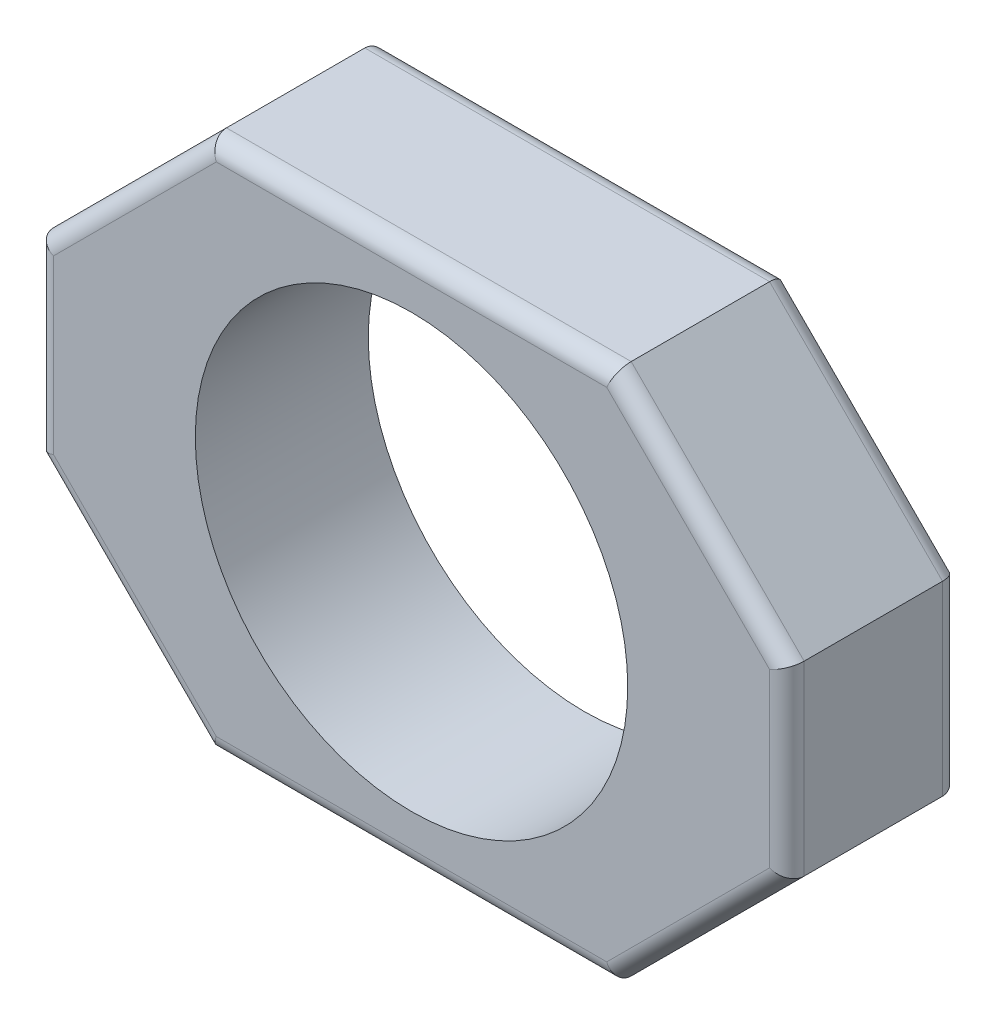
from build123d import *

# Parameters (mm, degrees)
SKETCH1_W           = 110.237040332
SKETCH1_H           = 78.14500721
BOSS_EXTRUDE1_DEPTH = 25.4
SKETCH2_R           = 31.75
CUT_EXTRUDE1_DEPTH  = 73.179441694
CHAMFER1_SIZE       = 25.4
FILLET1_R           = 2.54


with BuildPart() as part:
    # Sketch1 → Boss-Extrude1 (new body)
    with BuildSketch(Plane.XY):
        Rectangle(SKETCH1_W, SKETCH1_H)
    extrude(amount=-BOSS_EXTRUDE1_DEPTH)

    # Sketch2 → Cut-Extrude1 (cut, through all)
    with BuildSketch(Plane.XY):
        Circle(SKETCH2_R)
    extrude(amount=-CUT_EXTRUDE1_DEPTH, mode=Mode.SUBTRACT)

    # Chamfer1
    chamfer1_edges = [part.edges().sort_by_distance(p)[0] for p in [
        (-55.118520166, -39.072503605, -12.7),
        (55.118520166, -39.072503605, -12.7),
        (-55.118520166, 39.072503605, -12.7),
        (55.118520166, 39.072503605, -12.7),
    ]]
    chamfer(chamfer1_edges, length=CHAMFER1_SIZE)

    # Fillet1
    fillet1_edges = [part.edges().sort_by_distance(p)[0] for p in [
        (-42.418520166, 26.372503605, -25.4),
        (-55.118520166, 0, -25.4),
        (-42.418520166, -26.372503605, -25.4),
        (0, -39.072503605, -25.4),
        (42.418520166, -26.372503605, -25.4),
        (55.118520166, 0, -25.4),
        (0, 39.072503605, -25.4),
        (42.418520166, 26.372503605, -25.4),
        (-42.418520166, 26.372503605, 0),
        (-55.118520166, 0, 0),
        (-42.418520166, -26.372503605, 0),
        (0, -39.072503605, 0),
        (42.418520166, -26.372503605, 0),
        (55.118520166, 0, 0),
        (42.418520166, 26.372503605, 0),
        (0, 39.072503605, 0),
    ]]
    fillet(fillet1_edges, radius=FILLET1_R)


solid = part.part
